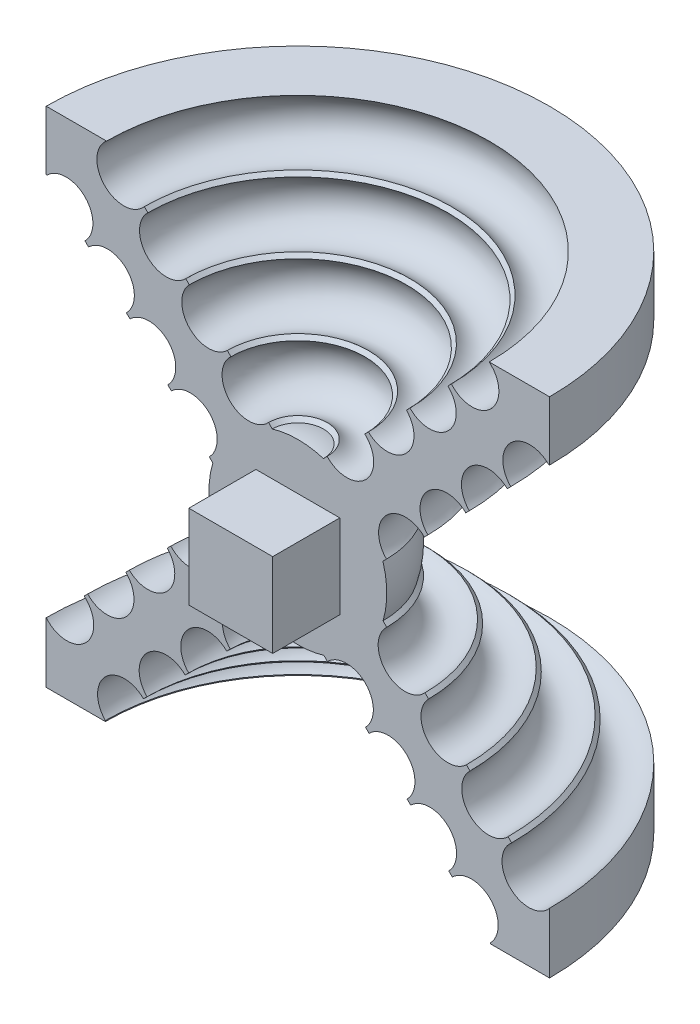
from build123d import *

# Parameters (mm, degrees)
SPHERICON_REVOLVE_ANGLE = 180
SKETCH2_W               = 6.35
SKETCH2_H               = 6.35
MALE_EXTRUDE_DEPTH      = 5.08


with BuildPart() as part:
    # Sketch1 → Sphericon Revolve (revolve)
    with BuildSketch(Plane.XY):
        with BuildLine():
            Line((-19.05, 14.570611464), (-18.980599794, 14.570611464))
            ThreePointArc((-18.980599794, 14.570611464), (-16.106926035, 14.563746368), (-16.11379113, 11.69007261))
            Line((-16.11379113, 11.69007261), (-15.845027818, 11.420022092))
            ThreePointArc((-15.845027818, 11.420022092), (-12.97135406, 11.413156997), (-12.978219155, 8.539483239))
            Line((-12.978219155, 8.539483239), (-12.709455843, 8.269432721))
            ThreePointArc((-12.709455843, 8.269432721), (-9.835782084, 8.262567626), (-9.842647179, 5.388893867))
            Line((-9.842647179, 5.388893867), (-9.573883867, 5.11884335))
            ThreePointArc((-9.573883867, 5.11884335), (-6.700210109, 5.111978254), (-6.707075204, 2.238304496))
            Line((-6.707075204, 2.238304496), (-6.436496608, 1.969231428))
            ThreePointArc((-6.436496608, 1.969231428), (-6.730980793, 0.016080052), (-6.445831922, -1.938456044))
            Line((-6.445831922, -1.938456044), (-6.727000174, -2.218284098))
            ThreePointArc((-6.727000174, -2.218284098), (-6.683206893, -5.154816446), (-9.618783184, -5.068029805))
            Line((-9.618783184, -5.068029805), (-9.891678831, -5.339627385))
            ThreePointArc((-9.891678831, -5.339627385), (-9.910192139, -8.189228808), (-12.75969361, -8.219434413))
            Line((-12.75969361, -8.219434413), (-13.029501015, -8.487955771))
            ThreePointArc((-13.029501015, -8.487955771), (-13.003508284, -11.394611844), (-15.91000699, -11.354731712))
            Line((-15.91000699, -11.354731712), (-16.180372544, -11.623808559))
            ThreePointArc((-16.180372544, -11.623808559), (-16.052425661, -14.622028438), (-19.05, -14.479757834))
            Line((-19.05, -14.479757834), (-19.05, -19.05))
            Line((-19.05, -19.05), (-14.570611464, -19.05))
            Line((-14.570611464, -19.05), (-14.570611464, -18.980599794))
            ThreePointArc((-14.570611464, -18.980599794), (-14.563746368, -16.106926035), (-11.69007261, -16.11379113))
            Line((-11.69007261, -16.11379113), (-11.420022092, -15.845027818))
            ThreePointArc((-11.420022092, -15.845027818), (-11.413156997, -12.97135406), (-8.539483239, -12.978219155))
            Line((-8.539483239, -12.978219155), (-8.269432721, -12.709455843))
            ThreePointArc((-8.269432721, -12.709455843), (-8.262567626, -9.835782084), (-5.388893867, -9.842647179))
            Line((-5.388893867, -9.842647179), (-5.11884335, -9.573883867))
            ThreePointArc((-5.11884335, -9.573883867), (-5.111978254, -6.700210109), (-2.238304496, -6.707075204))
            Line((-2.238304496, -6.707075204), (-1.969231428, -6.436496608))
            ThreePointArc((-1.969231428, -6.436496608), (-0.995565752, -6.656967015), (0, -6.731))
            Line((0, -6.731), (0, 6.731))
            ThreePointArc((0, 6.731), (-0.97965972, 6.65932638), (-1.938456044, 6.445831922))
            Line((-1.938456044, 6.445831922), (-2.218284098, 6.727000174))
            ThreePointArc((-2.218284098, 6.727000174), (-5.154816446, 6.683206893), (-5.068029805, 9.618783184))
            Line((-5.068029805, 9.618783184), (-5.339627385, 9.891678831))
            ThreePointArc((-5.339627385, 9.891678831), (-8.189228808, 9.910192139), (-8.219434413, 12.75969361))
            Line((-8.219434413, 12.75969361), (-8.487955771, 13.029501015))
            ThreePointArc((-8.487955771, 13.029501015), (-11.394611844, 13.003508284), (-11.354731712, 15.91000699))
            Line((-11.354731712, 15.91000699), (-11.623808559, 16.180372544))
            ThreePointArc((-11.623808559, 16.180372544), (-14.622028438, 16.052425661), (-14.479757834, 19.05))
            Line((-14.479757834, 19.05), (-19.05, 19.05))
            Line((-19.05, 19.05), (-19.05, 14.570611464))
        make_face()
    revolve(axis=Axis((0, 19.05, 0), (0, -1, 0)), revolution_arc=SPHERICON_REVOLVE_ANGLE)

    # Sketch2 → Male Extrude (add)
    with BuildSketch(Plane.XY):
        Rectangle(SKETCH2_W, SKETCH2_H)
    extrude(amount=MALE_EXTRUDE_DEPTH)


solid = part.part
